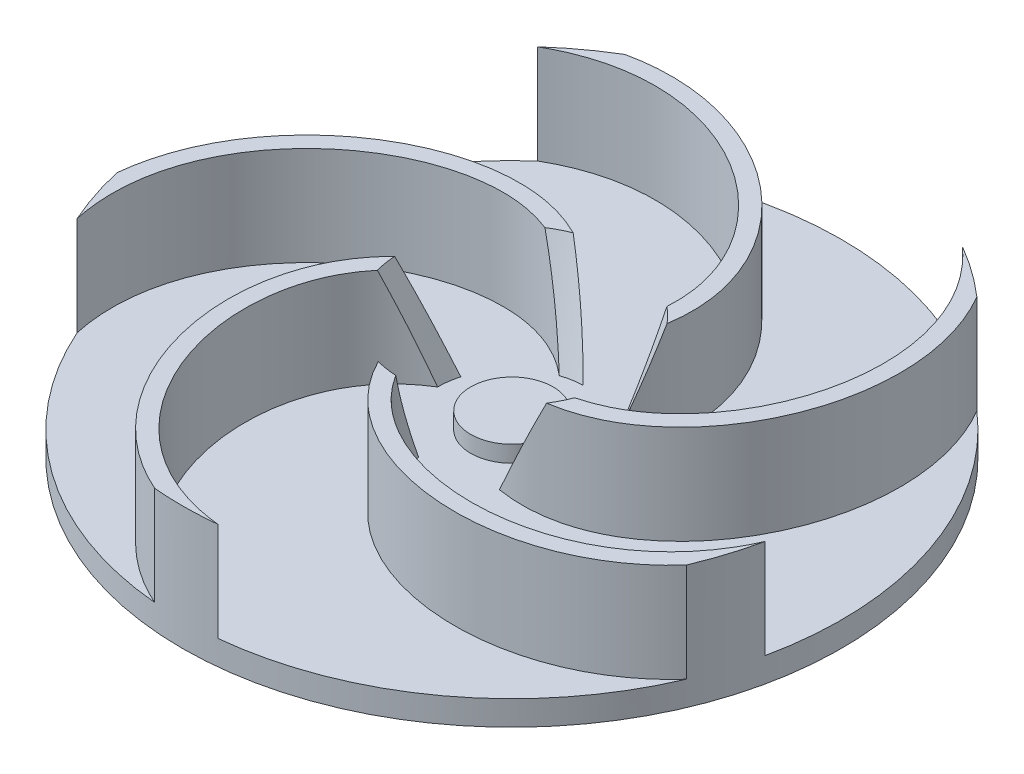
from build123d import *

# Parameters (mm, degrees)
BOSS_EXTRUDE1_DEPTH      = 2
BOSS_EXTRUDE1_DEPTH_BACK = 1
SKETCH1_R                = 40
BOSS_EXTRUDE2_DEPTH      = 12
CIRPATTERN1_COUNT        = 5
SKETCH4_R                = 5
BOSS_EXTRUDE3_DEPTH      = 2


with BuildPart() as part:
    # Sketch1 → Boss-Extrude1 (new, two sides: drawn at the far end of the back side and taken through both)
    with BuildSketch(Plane(origin=(0, 0, 0), x_dir=(1, 0, 0), z_dir=(0, 1, 0)).offset(-BOSS_EXTRUDE1_DEPTH_BACK)):
        Circle(SKETCH1_R)
    extrude(amount=BOSS_EXTRUDE1_DEPTH + BOSS_EXTRUDE1_DEPTH_BACK)

    # Sketch2 → Boss-Extrude2 (add)
    with BuildSketch(Plane(origin=(0, 2, 0), x_dir=(1, 0, 0), z_dir=(0, 1, 0))):
        with BuildLine():
            add(Edge.make_bspline(
                [(-1.648457537, 7.469358199), (-2.104873805, 7.937868262), (-3.086385024, 8.83695283), (-5.118879824, 10.300544164), (-7.85339222, 11.617216343), (-11.343679645, 12.411124094), (-16.177419051, 12.495643266), (-22.32154029, 10.877489917), (-29.038746805, 6.570733882), (-33.401405456, 1.389922557), (-35.761319101, -3.474155864), (-36.874262221, -7.426752725), (-37.238472583, -11.634394908), (-36.915436622, -14.613747914), (-36.587236294, -16.149943806), (-36.580010635, -16.183411937)],
                knots=[0, 0, 0, 0, 0.03125, 0.0625, 0.125, 0.1875, 0.25, 0.375, 0.5, 0.625, 0.6875, 0.75, 0.8125, 0.875, 0.876391371, 0.876391371, 0.876391371, 0.876391371], degree=3))
            Line((-1.648457537, 7.469358199), (-0.215875004, 8.864961038))
            add(Edge.make_bspline(
                [(-0.215875004, 8.864961038), (-0.725572372, 9.388164005), (-1.819134041, 10.389961885), (-4.104895535, 12.036976258), (-7.191277155, 13.522686378), (-11.109594838, 14.411975027), (-16.471086792, 14.501770787), (-23.156943321, 12.729175608), (-30.376376148, 8.096753493), (-35.077876345, 2.519665418), (-37.639776615, -2.757260327), (-38.616179028, -6.222859697), (-38.916318413, -8.348122546), (-38.979627679, -8.9771168)],
                knots=[0, 0, 0, 0, 0.03125, 0.0625, 0.125, 0.1875, 0.25, 0.375, 0.5, 0.625, 0.6875, 0.75, 0.775839178, 0.775839178, 0.775839178, 0.775839178], degree=3))
            ThreePointArc((-38.979627679, -8.9771168), (-37.951250413, -12.637349092), (-36.580010635, -16.183411937))
        make_face()
    boss_extrude2 = extrude(amount=BOSS_EXTRUDE2_DEPTH)

    # CirPattern1: Boss-Extrude2 ×5 about axis
    cirpattern1_axis = Axis((0, 2, 0), (0, 1, 0))
    for i in range(1, CIRPATTERN1_COUNT):
        add(boss_extrude2.rotate(cirpattern1_axis, i * 360 / CIRPATTERN1_COUNT))

    # Sketch3 → Cut-Revolve1 (revolve, cut)
    with BuildSketch(Plane.XY):
        Polygon((0, 2), (-9, 2), (-13.731613045, 15), (0, 15), align=None)
    revolve(axis=Axis((0, 15, 0), (0, -1, 0)), mode=Mode.SUBTRACT)

    # Sketch4 → Boss-Extrude3 (add)
    with BuildSketch(Plane(origin=(0, 2, 0), x_dir=(1, 0, 0), z_dir=(0, 1, 0))):
        Circle(SKETCH4_R)
    extrude(amount=BOSS_EXTRUDE3_DEPTH)


solid = part.part
